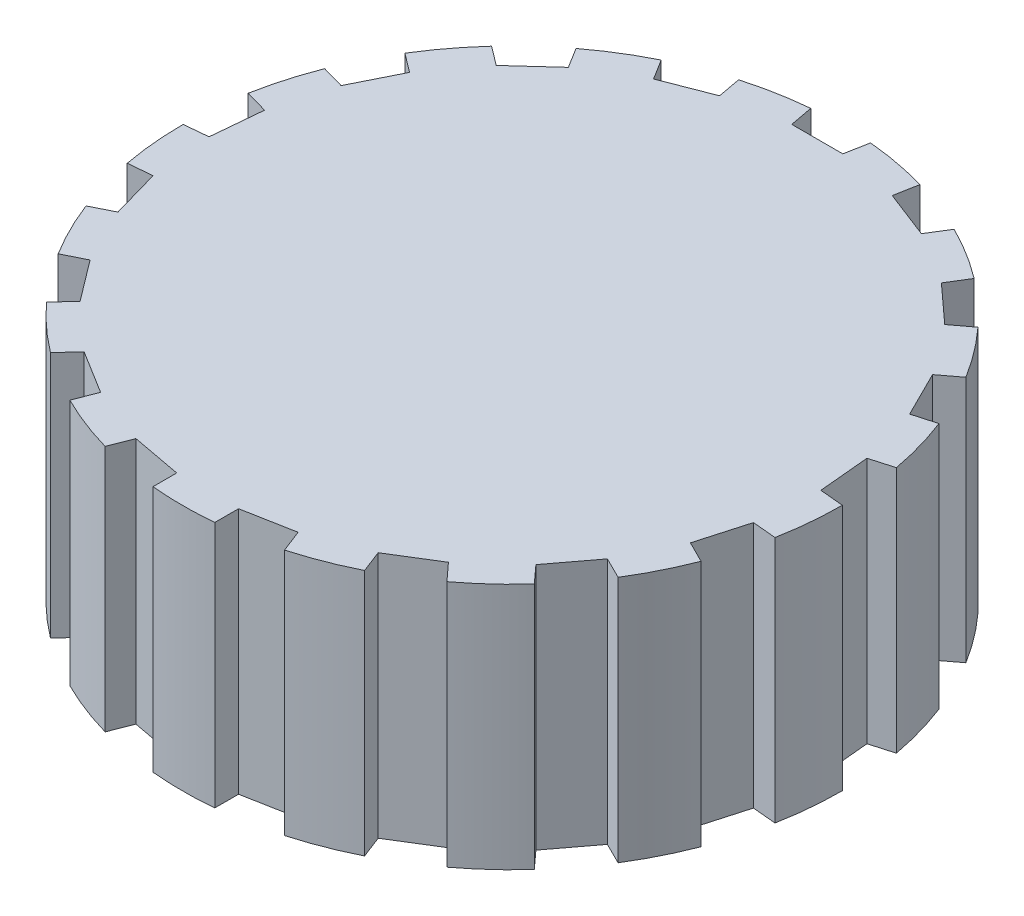
from build123d import *

# Parameters (mm, degrees)
SKETCH5_R           = 25.4
BOSS_EXTRUDE2_DEPTH = 19.05
CUT_EXTRUDE1_DEPTH  = 22.05
CIRPATTERN1_COUNT   = 17


with BuildPart() as part:
    # Sketch5 → Boss-Extrude2 (new body)
    with BuildSketch(Plane(origin=(0, 0, 0), x_dir=(1, 0, 0), z_dir=(0, 1, 0))):
        Circle(SKETCH5_R)
    extrude(amount=BOSS_EXTRUDE2_DEPTH)

    # Sketch8 → Cut-Extrude1 (cut)
    with BuildSketch(Plane(origin=(0, 19.05, 0), x_dir=(1, 0, 0), z_dir=(0, 1, 0))):
        Polygon((0.008891127, 25.4), (2.332991127, 25.4), (1.974611644, 23.495), (-1.95682939, 23.495), (-2.315208873, 25.4), align=None)
    cut_extrude1 = extrude(amount=-CUT_EXTRUDE1_DEPTH, mode=Mode.SUBTRACT)

    # CirPattern1: Cut-Extrude1 ×17 about axis
    cirpattern1_axis = Axis((0, 19.05, 0), (0, 1, 0))
    for i in range(1, CIRPATTERN1_COUNT):
        add(cut_extrude1.rotate(cirpattern1_axis, i * 360 / CIRPATTERN1_COUNT), mode=Mode.SUBTRACT)


solid = part.part
